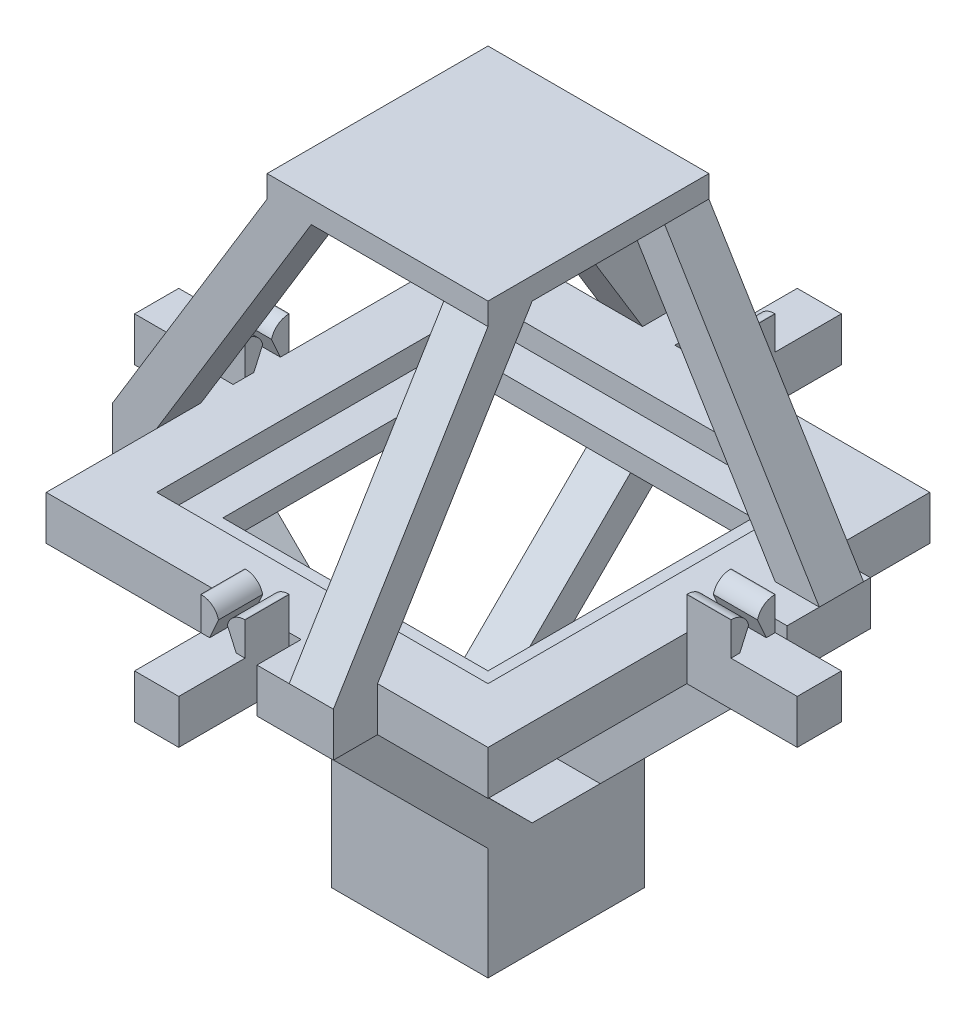
from build123d import *

# Parameters (mm, degrees)
SKETCH2_W            = 100
SKETCH2_H            = 100
BOSS_EXTRUDE1_DEPTH  = 5
SKETCH3_W            = 100
SKETCH3_H            = 100
BOSS_EXTRUDE2_DEPTH  = 5
SKETCH8_R            = 5
BOSS_EXTRUDE7_DEPTH  = 30
BOSS_EXTRUDE21_DEPTH = 10
FILLET14_R           = 4
FILLET13_R           = 4
SKETCH24_W           = 10
SKETCH24_H           = 10
BOSS_EXTRUDE22_DEPTH = 15
BOSS_EXTRUDE25_DEPTH = 10
SKETCH26_W           = 10
SKETCH26_H           = 10
BOSS_EXTRUDE26_DEPTH = 15
FILLET18_R           = 4
FILLET17_R           = 4
BOSS_EXTRUDE23_DEPTH = 10
SKETCH25_W           = 10
SKETCH25_H           = 10
BOSS_EXTRUDE24_DEPTH = 15
FILLET15_R           = 4
FILLET16_R           = 4
BOSS_EXTRUDE10_DEPTH = 10
FILLET19_R           = 4
SKETCH27_W           = 10
SKETCH27_H           = 10
BOSS_EXTRUDE27_DEPTH = 15
FILLET20_R           = 4
SKETCH62_R           = 11.223510807
CUT_EXTRUDE3_DEPTH   = 30
SKETCH64_W           = 35.4
SKETCH64_H           = 35.4
BOSS_EXTRUDE53_DEPTH = 25.4
SKETCH66_W           = 25.4
SKETCH66_H           = 25.4
CUT_EXTRUDE4_DEPTH   = 12.7
SKETCH67_W           = 50
SKETCH67_H           = 50
BOSS_EXTRUDE54_DEPTH = 5
SKETCH68_W           = 17.3
SKETCH68_H           = 10
BOSS_EXTRUDE55_DEPTH = 10
SKETCH69_W           = 17.3
SKETCH69_H           = 10
BOSS_EXTRUDE56_DEPTH = 10
SKETCH70_W           = 17.3
SKETCH70_H           = 10
BOSS_EXTRUDE57_DEPTH = 10
SKETCH74_W           = 17.3
SKETCH74_H           = 10
BOSS_EXTRUDE58_DEPTH = 10
BOSS_EXTRUDE59_DEPTH = 10
BOSS_EXTRUDE60_DEPTH = 10
BOSS_EXTRUDE61_DEPTH = 10
BOSS_EXTRUDE62_DEPTH = 10
BOSS_EXTRUDE63_DEPTH = 10
BOSS_EXTRUDE64_DEPTH = 10
SKETCH85_W           = 17.3
SKETCH85_H           = 10
BOSS_EXTRUDE65_DEPTH = 10
BOSS_EXTRUDE66_DEPTH = 10
BOSS_EXTRUDE67_DEPTH = 10
SKETCH90_W           = 75
SKETCH90_H           = 75
CUT_EXTRUDE5_DEPTH   = 5
SKETCH91_W           = 60
SKETCH91_H           = 60
CUT_EXTRUDE6_DEPTH   = 10


with BuildPart() as part:
    # Sketch2 → Boss-Extrude1 (new body)
    with BuildSketch(Plane(origin=(0, 0, 0), x_dir=(1, 0, 0), z_dir=(0, 1, 0))):
        Rectangle(SKETCH2_W, SKETCH2_H)
    extrude(amount=BOSS_EXTRUDE1_DEPTH)

    # Sketch3 → Boss-Extrude2 (add)
    with BuildSketch(Plane.XZ):
        Rectangle(SKETCH3_W, SKETCH3_H)
    extrude(amount=BOSS_EXTRUDE2_DEPTH)

    # Sketch8 → Boss-Extrude7 (add)
    with BuildSketch(Plane.XZ.offset(5)):
        with Locations(Location((0, 0, 0), (0, 0, 90))):
            Circle(SKETCH8_R)
    extrude(amount=BOSS_EXTRUDE7_DEPTH)

    # Sketch11 → Boss-Extrude21 (add)
    with BuildSketch(Plane(origin=(50, 0, 0), x_dir=(0, 0, -1), z_dir=(1, 0, 0))):
        Polygon((5, -5), (5, 12.5), (1, 12.5), (1, 9.5), (3, 5), (-3, 5), (-1, 9.5), (-1, 12.5), (-5, 12.5), (-5, -5), align=None)
    extrude(amount=BOSS_EXTRUDE21_DEPTH)

    # Fillet14
    # the kernel refuses this fillet: 4 mm, written as the material it takes off along each edge
    with BuildSketch(Plane(origin=(40.317541634, 12.5, -1), x_dir=(0, -1, 0), z_dir=(1, 0, 0))) as fillet14_piece_1:
        with BuildLine():
            CenterArc((4, 3.872983346), FILLET14_R, 180, 75.522487814)
            Line((0, 3.872983346), (-0.08, 3.872983346))
            Line((-0.08, 3.872983346), (-0.08, 0))
            Line((-0.08, 0), (0, -0.08))
            ThreePointArc((0, -0.08), (1.5, -0.08), (2.98, -0.077459667))
            Line((2.98, -0.077459667), (3, 0))
        make_face()
    extrude(amount=29.364916731, mode=Mode.SUBTRACT)

    # Fillet13
    # the kernel refuses this fillet: 4 mm, written as the material it takes off along each edge
    with BuildSketch(Plane(origin=(40.317541634, 12.5, 1), x_dir=(0, 0, 1), z_dir=(1, 0, 0))) as fillet13_piece_1:
        with BuildLine():
            CenterArc((3.872983346, 4), FILLET13_R, 194.477512186, 75.522487814)
            Line((0, 3), (-0.077459667, 2.98))
            ThreePointArc((-0.077459667, 2.98), (-0.08, 1.5), (-0.08, 0))
            Line((-0.08, 0), (0, -0.08))
            Line((0, -0.08), (3.872983346, -0.08))
            Line((3.872983346, -0.08), (3.872983346, 0))
        make_face()
    extrude(amount=29.364916731, mode=Mode.SUBTRACT)

    # Sketch24 → Boss-Extrude22 (add)
    with BuildSketch(Plane(origin=(60, 0, 0), x_dir=(0, 0, -1), z_dir=(1, 0, 0))):
        Rectangle(SKETCH24_W, SKETCH24_H)
    extrude(amount=BOSS_EXTRUDE22_DEPTH)

    # Sketch13 → Boss-Extrude25 (add)
    with BuildSketch(Plane.ZY.offset(50)):
        Polygon((-5, 12.5), (-5, -5), (5, -5), (5, 12.5), (1, 12.5), (1, 9.5), (3, 5), (-3, 5), (-1, 9.5), (-1, 12.5), align=None)
    extrude(amount=BOSS_EXTRUDE25_DEPTH)

    # Sketch26 → Boss-Extrude26 (add)
    with BuildSketch(Plane.ZY.offset(60)):
        Rectangle(SKETCH26_W, SKETCH26_H)
    extrude(amount=BOSS_EXTRUDE26_DEPTH)

    # Fillet18
    # the kernel refuses this fillet: 4 mm, written as the material it takes off along each edge
    with BuildSketch(Plane(origin=(-40.317541634, 12.5, 1), x_dir=(0, -1, 0), z_dir=(-1, 0, 0))) as fillet18_piece_1:
        with BuildLine():
            CenterArc((4, 3.872983346), FILLET18_R, 180, 75.522487814)
            Line((0, 3.872983346), (-0.08, 3.872983346))
            Line((-0.08, 3.872983346), (-0.08, 0))
            Line((-0.08, 0), (0, -0.08))
            ThreePointArc((0, -0.08), (1.5, -0.08), (2.98, -0.077459667))
            Line((2.98, -0.077459667), (3, 0))
        make_face()
    extrude(amount=29.364916731, mode=Mode.SUBTRACT)

    # Fillet17
    # the kernel refuses this fillet: 4 mm, written as the material it takes off along each edge
    with BuildSketch(Plane(origin=(-40.317541634, 12.5, -1), x_dir=(0, 0, -1), z_dir=(-1, 0, 0))) as fillet17_piece_1:
        with BuildLine():
            CenterArc((3.872983346, 4), FILLET17_R, 194.477512186, 75.522487814)
            Line((0, 3), (-0.077459667, 2.98))
            ThreePointArc((-0.077459667, 2.98), (-0.08, 1.5), (-0.08, 0))
            Line((-0.08, 0), (0, -0.08))
            Line((0, -0.08), (3.872983346, -0.08))
            Line((3.872983346, -0.08), (3.872983346, 0))
        make_face()
    extrude(amount=29.364916731, mode=Mode.SUBTRACT)

    # Sketch14 → Boss-Extrude23 (add)
    with BuildSketch(Plane(origin=(0, 0, -50), x_dir=(-1, 0, 0), z_dir=(0, 0, -1))):
        Polygon((-5, 12.5), (-1, 12.5), (-1, 9.5), (-3, 5), (3, 5), (1, 9.5), (1, 12.5), (5, 12.5), (5, -5), (-5, -5), align=None)
    extrude(amount=BOSS_EXTRUDE23_DEPTH)

    # Sketch25 → Boss-Extrude24 (add)
    with BuildSketch(Plane(origin=(0, 0, -60), x_dir=(-1, 0, 0), z_dir=(0, 0, -1))):
        Rectangle(SKETCH25_W, SKETCH25_H)
    extrude(amount=BOSS_EXTRUDE24_DEPTH)

    # Fillet15
    # the kernel refuses this fillet: 4 mm, written as the material it takes off along each edge
    with BuildSketch(Plane(origin=(-1, 12.5, -40.317541634), x_dir=(0, -1, 0), z_dir=(0, 0, -1))) as fillet15_piece_1:
        with BuildLine():
            CenterArc((4, 3.872983346), FILLET15_R, 180, 75.522487814)
            Line((0, 3.872983346), (-0.08, 3.872983346))
            Line((-0.08, 3.872983346), (-0.08, 0))
            Line((-0.08, 0), (0, -0.08))
            ThreePointArc((0, -0.08), (1.5, -0.08), (2.98, -0.077459667))
            Line((2.98, -0.077459667), (3, 0))
        make_face()
    extrude(amount=29.364916731, mode=Mode.SUBTRACT)

    # Fillet16
    # the kernel refuses this fillet: 4 mm, written as the material it takes off along each edge
    with BuildSketch(Plane(origin=(1, 12.5, -40.317541634), x_dir=(0, -1, 0), z_dir=(0, 0, -1))) as fillet16_piece_1:
        with BuildLine():
            CenterArc((4, -3.872983346), FILLET16_R, 104.477512186, 75.522487814)
            Line((0, -3.872983346), (-0.08, -3.872983346))
            Line((-0.08, -3.872983346), (-0.08, 0))
            Line((-0.08, 0), (0, 0.08))
            ThreePointArc((0, 0.08), (1.5, 0.08), (2.98, 0.077459667))
            Line((2.98, 0.077459667), (3, 0))
        make_face()
    extrude(amount=29.364916731, mode=Mode.SUBTRACT)

    # Sketch12 → Boss-Extrude10 (add)
    with BuildSketch(Plane.XY.offset(50)):
        Polygon((-5, 12.5), (-5, -5), (5, -5), (5, 12.5), (1, 12.5), (1, 9.5), (3, 5), (-3, 5), (-1, 9.5), (-1, 12.5), align=None)
    extrude(amount=BOSS_EXTRUDE10_DEPTH)

    # Fillet19
    # the kernel refuses this fillet: 4 mm, written as the material it takes off along each edge
    with BuildSketch(Plane(origin=(-1, 12.5, 40.317541634), x_dir=(-1, 0, 0), z_dir=(0, 0, 1))) as fillet19_piece_1:
        with BuildLine():
            CenterArc((3.872983346, 4), FILLET19_R, 194.477512186, 75.522487814)
            Line((0, 3), (-0.077459667, 2.98))
            ThreePointArc((-0.077459667, 2.98), (-0.08, 1.5), (-0.08, 0))
            Line((-0.08, 0), (0, -0.08))
            Line((0, -0.08), (3.872983346, -0.08))
            Line((3.872983346, -0.08), (3.872983346, 0))
        make_face()
    extrude(amount=29.364916731, mode=Mode.SUBTRACT)

    # Sketch27 → Boss-Extrude27 (add)
    with BuildSketch(Plane.XY.offset(60)):
        Rectangle(SKETCH27_W, SKETCH27_H)
    extrude(amount=BOSS_EXTRUDE27_DEPTH)

    # Fillet20
    # the kernel refuses this fillet: 4 mm, written as the material it takes off along each edge
    with BuildSketch(Plane(origin=(1, 12.5, 40.317541634), x_dir=(1, 0, 0), z_dir=(0, 0, 1))) as fillet20_piece_1:
        with BuildLine():
            CenterArc((3.872983346, -4), FILLET20_R, 90, 75.522487814)
            Line((0, -3), (-0.077459667, -2.98))
            ThreePointArc((-0.077459667, -2.98), (-0.08, -1.5), (-0.08, 0))
            Line((-0.08, 0), (0, 0.08))
            Line((0, 0.08), (3.872983346, 0.08))
            Line((3.872983346, 0.08), (3.872983346, 0))
        make_face()
    extrude(amount=29.364916731, mode=Mode.SUBTRACT)

    # Sketch62 → Cut-Extrude3 (cut)
    with BuildSketch(Plane.XZ.offset(5)):
        Circle(SKETCH62_R)
    extrude(amount=CUT_EXTRUDE3_DEPTH, mode=Mode.SUBTRACT)

    # Sketch68 → Boss-Extrude55 (add)
    with BuildSketch(Plane.XY.offset(50)):
        with Locations((16.35, 0)):
            Rectangle(SKETCH68_W, SKETCH68_H)
    extrude(amount=BOSS_EXTRUDE55_DEPTH)

    # Sketch69 → Boss-Extrude56 (add)
    with BuildSketch(Plane(origin=(50, 0, 0), x_dir=(0, 0, -1), z_dir=(1, 0, 0))):
        with Locations((17.90253263, 0)):
            Rectangle(SKETCH69_W, SKETCH69_H)
    extrude(amount=BOSS_EXTRUDE56_DEPTH)

    # Sketch70 → Boss-Extrude57 (add)
    with BuildSketch(Plane(origin=(0, 0, -50), x_dir=(-1, 0, 0), z_dir=(0, 0, -1))):
        with Locations((16.35, 0)):
            Rectangle(SKETCH70_W, SKETCH70_H)
    extrude(amount=BOSS_EXTRUDE57_DEPTH)

    # Sketch74 → Boss-Extrude58 (add)
    with BuildSketch(Plane.ZY.offset(50)):
        with Locations((16.35, 0)):
            Rectangle(SKETCH74_W, SKETCH74_H)
    extrude(amount=BOSS_EXTRUDE58_DEPTH)



with BuildPart() as body_2:
    # Sketch64 → Boss-Extrude53 (new body)
    with BuildSketch(Plane(origin=(0, -72.5, 0), x_dir=(1, 0, 0), z_dir=(0, 1, 0))):
        Rectangle(SKETCH64_W, SKETCH64_H)
    extrude(amount=BOSS_EXTRUDE53_DEPTH)

    # Sketch66 → Cut-Extrude4 (cut)
    with BuildSketch(Plane(origin=(0, -72.5, 0), x_dir=(-1, 0, 0), z_dir=(0, -1, 0))):
        Rectangle(SKETCH66_W, SKETCH66_H)
    extrude(amount=-CUT_EXTRUDE4_DEPTH, mode=Mode.SUBTRACT)


with BuildPart() as body_3:
    # Sketch67 → Boss-Extrude54 (new body)
    with BuildSketch(Plane(origin=(0, 67.5, 0), x_dir=(1, 0, 0), z_dir=(0, 1, 0))):
        Rectangle(SKETCH67_W, SKETCH67_H)
    extrude(amount=-BOSS_EXTRUDE54_DEPTH)


with BuildPart() as part_1:
    add(part.part)

    add(body_2.part)  # Boss-Extrude59 merges body 2
    # Sketch76 → Boss-Extrude59 (add)
    with BuildSketch(Plane.ZY.offset(17.7)):
        Polygon((-17.7, -47.1), (-60, -5), (-50, -5), (-7.7, -47.1), align=None)
    extrude(amount=-BOSS_EXTRUDE59_DEPTH)


    add(body_3.part)  # Boss-Extrude60 merges body 3
    # Sketch77 → Boss-Extrude60 (add)
    with BuildSketch(Plane.ZY.offset(25)):
        Polygon((-25, 62.5), (-60, 5), (-50, 5), (-15, 62.5), align=None)
    extrude(amount=-BOSS_EXTRUDE60_DEPTH)

    # Sketch78 → Boss-Extrude61 (add)
    with BuildSketch(Plane.XY.offset(17.7)):
        Polygon((-17.7, -47.1), (-60, -5), (-50, -5), (-7.7, -47.1), align=None)
    extrude(amount=-BOSS_EXTRUDE61_DEPTH)

    # Sketch79 → Boss-Extrude62 (add)
    with BuildSketch(Plane.XY.offset(25)):
        Polygon((-25, 62.5), (-60, 5), (-50, 5), (-15, 62.5), align=None)
    extrude(amount=-BOSS_EXTRUDE62_DEPTH)

    # Sketch82 → Boss-Extrude63 (add)
    with BuildSketch(Plane(origin=(17.7, 0, 0), x_dir=(0, 0, -1), z_dir=(1, 0, 0))):
        Polygon((-60, -5), (-17.7, -47.1), (-7.7, -47.1), (-50, -5), align=None)
    extrude(amount=-BOSS_EXTRUDE63_DEPTH)

    # Sketch83 → Boss-Extrude64 (add)
    with BuildSketch(Plane(origin=(25, 0, 0), x_dir=(0, 0, -1), z_dir=(1, 0, 0))):
        Polygon((-25, 62.5), (-60, 5), (-50, 5), (-15, 62.5), align=None)
    extrude(amount=-BOSS_EXTRUDE64_DEPTH)

    # Sketch85 → Boss-Extrude65 (add)
    with BuildSketch(Plane(origin=(50, 0, 0), x_dir=(0, 0, -1), z_dir=(1, 0, 0))):
        with Locations((16.35, 0)):
            Rectangle(SKETCH85_W, SKETCH85_H)
    extrude(amount=BOSS_EXTRUDE65_DEPTH)

    # Sketch86 → Boss-Extrude66 (add)
    with BuildSketch(Plane(origin=(0, 0, -25), x_dir=(-1, 0, 0), z_dir=(0, 0, -1))):
        Polygon((-25, 62.5), (-60, 5), (-50, 5), (-15, 62.5), align=None)
    extrude(amount=-BOSS_EXTRUDE66_DEPTH)

    # Sketch89 → Boss-Extrude67 (add)
    with BuildSketch(Plane(origin=(0, 0, -17.7), x_dir=(-1, 0, 0), z_dir=(0, 0, -1))):
        Polygon((-60, -5), (-50, -5), (-7.7, -47.1), (-17.7, -47.1), align=None)
    extrude(amount=-BOSS_EXTRUDE67_DEPTH)

    # Sketch90 → Cut-Extrude5 (cut)
    with BuildSketch(Plane(origin=(0, 5, 0), x_dir=(1, 0, 0), z_dir=(0, 1, 0))):
        Rectangle(SKETCH90_W, SKETCH90_H)
    extrude(amount=-CUT_EXTRUDE5_DEPTH, mode=Mode.SUBTRACT)

    # Sketch91 → Cut-Extrude6 (cut)
    with BuildSketch(Plane(origin=(0, 5, 0), x_dir=(1, 0, 0), z_dir=(0, 1, 0))):
        Rectangle(SKETCH91_W, SKETCH91_H)
    extrude(amount=-CUT_EXTRUDE6_DEPTH, mode=Mode.SUBTRACT)


solid = part_1.part
